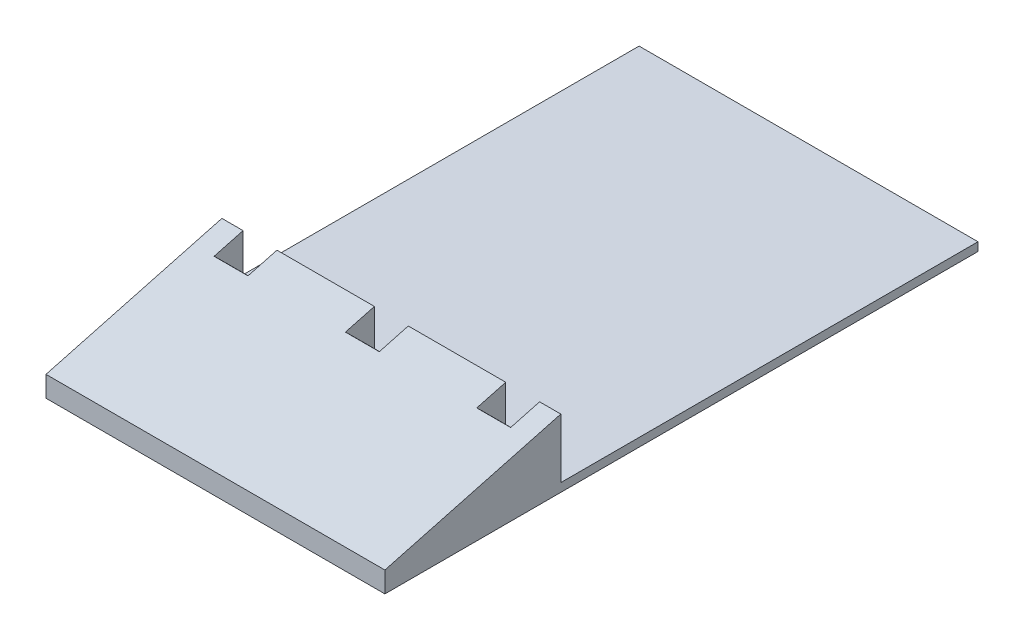
from build123d import *

# Parameters (mm, degrees)
SKETCH1_W                = 400
SKETCH1_H                = 700
BOSS_EXTRUDE1_DEPTH      = 10
BOSS_EXTRUDE2_DEPTH      = 200
BOSS_EXTRUDE2_DEPTH_BACK = 200
CUT_EXTRUDE3_DEPTH       = 20
CUT_EXTRUDE3_DEPTH_BACK  = 20
CUT_EXTRUDE4_DEPTH       = 20
CUT_EXTRUDE4_DEPTH_BACK  = 20
CUT_EXTRUDE5_DEPTH       = 20
CUT_EXTRUDE5_DEPTH_BACK  = 20
SHELL3_START             = -189.5
SHELL3_DEPTH             = 379
SHELL3_START_2           = -124.5
SHELL3_2_DEPTH           = 94
SHELL3_START_3           = 30.5
SHELL3_3_DEPTH           = 94
SHELL3_4_DEPTH           = 4
SHELL3_START_4           = 185.5
SHELL3_5_DEPTH           = 4
SHELL3_START_5           = -30.5
SHELL3_6_DEPTH           = 61
FILLET1_R                = 100


# Read off the part's stored shape, not the designer's step: Shell3
with BuildPart() as part:
    # Sketch1 → Boss-Extrude1 (new body)
    with BuildSketch(Plane(origin=(0, 0, 0), x_dir=(1, 0, 0), z_dir=(0, 1, 0))):
        with Locations((0, 350)):
            Rectangle(SKETCH1_W, SKETCH1_H)
    extrude(amount=BOSS_EXTRUDE1_DEPTH)

    # Sketch2 → Boss-Extrude2 (add, two sides: drawn at the far end of the back side and taken through both)
    with BuildSketch(Plane(origin=(0, 0, 0), x_dir=(0, 0, -1), z_dir=(1, 0, 0)).offset(-BOSS_EXTRUDE2_DEPTH_BACK)):
        Polygon((0, 0), (0, 24.464411704), (101.405231438, 51.629278733), (207.601036066, 80.077464993), (207.601036066, 0), align=None)
    extrude(amount=BOSS_EXTRUDE2_DEPTH + BOSS_EXTRUDE2_DEPTH_BACK)

    # Sketch5 → Cut-Extrude3 (cut, two sides: drawn at the far end of the back side and taken through both)
    with BuildSketch(Plane(origin=(0, 0, 0), x_dir=(0, 0, -1), z_dir=(1, 0, 0)).offset(-CUT_EXTRUDE3_DEPTH_BACK)):
        with BuildLine():
            Line((207.651134237, 88.230641516), (207.651134237, 10))
            ThreePointArc((207.651134237, 10), (195.644591457, 43.3333125), (173.411266827, 70.918563406))
            Line((173.411266827, 70.918563406), (207.651134237, 88.230641516))
        make_face()
    extrude(amount=CUT_EXTRUDE3_DEPTH + CUT_EXTRUDE3_DEPTH_BACK, mode=Mode.SUBTRACT)

    # Sketch7 → Cut-Extrude4 (cut, two sides: drawn at the far end of the back side and taken through both)
    with BuildSketch(Plane(origin=(155, 0, 0), x_dir=(0, 0, -1), z_dir=(1, 0, 0)).offset(-CUT_EXTRUDE4_DEPTH_BACK)):
        with BuildLine():
            Line((207.601036066, 80.077464993), (207.601036066, 10))
            ThreePointArc((207.601036066, 10), (195.617643187, 43.328041458), (173.411266827, 70.918563406))
            Line((173.411266827, 70.918563406), (164.696313807, 94.748714882))
            Line((164.696313807, 94.748714882), (211.114914406, 101.759857681))
            Line((211.114914406, 101.759857681), (207.601036066, 80.077464993))
        make_face()
    extrude(amount=CUT_EXTRUDE4_DEPTH + CUT_EXTRUDE4_DEPTH_BACK, mode=Mode.SUBTRACT)

    # Sketch8 → Cut-Extrude5 (cut, two sides: drawn at the far end of the back side and taken through both)
    with BuildSketch(Plane(origin=(-155, 0, 0), x_dir=(0, 0, -1), z_dir=(1, 0, 0)).offset(-CUT_EXTRUDE5_DEPTH_BACK)):
        with BuildLine():
            Line((207.601036066, 10), (207.601036066, 80.077464993))
            Line((207.601036066, 80.077464993), (173.411266827, 70.918563406))
            ThreePointArc((173.411266827, 70.918563406), (195.617643187, 43.328041458), (207.601036066, 10))
        make_face()
    extrude(amount=CUT_EXTRUDE5_DEPTH + CUT_EXTRUDE5_DEPTH_BACK, mode=Mode.SUBTRACT)

    # Shell3 outline → Shell3 (cut)
    with BuildSketch(Plane.YZ.offset(SHELL3_START)):
        with BuildLine():
            Line((10.5, -10.5), (10.5, -196.809675626))
            ThreePointArc((10.5, -196.809675626), (36.812126695, -187.219283255), (59.262427205, -170.477489921))
            Line((59.262427205, -170.477489921), (16.406973107, -10.5))
            Line((16.406973107, -10.5), (10.5, -10.5))
        make_face()
    extrude(amount=SHELL3_DEPTH, mode=Mode.SUBTRACT)

    # Shell3 2 outline → Shell3 2 (cut)
    with BuildSketch(Plane.YZ.offset(SHELL3_START_2)):
        with BuildLine():
            Line((10.5, -207.601036066), (69.207241495, -207.601036066))
            Line((69.207241495, -207.601036066), (59.262427205, -170.477489921))
            ThreePointArc((59.262427205, -170.477489921), (36.812126695, -187.219283255), (10.5, -196.809675626))
            Line((10.5, -196.809675626), (10.5, -207.601036066))
        make_face()
    extrude(amount=SHELL3_2_DEPTH, mode=Mode.SUBTRACT)

    # Shell3 3 outline → Shell3 3 (cut)
    with BuildSketch(Plane.YZ.offset(SHELL3_START_3)):
        with BuildLine():
            Line((10.5, -207.601036066), (69.207241495, -207.601036066))
            Line((69.207241495, -207.601036066), (59.262427205, -170.477489921))
            ThreePointArc((59.262427205, -170.477489921), (36.812126695, -187.219283255), (10.5, -196.809675626))
            Line((10.5, -196.809675626), (10.5, -207.601036066))
        make_face()
    extrude(amount=SHELL3_3_DEPTH, mode=Mode.SUBTRACT)

    # Shell3 4 outline → Shell3 4 (cut)
    with BuildSketch(Plane.YZ.offset(SHELL3_START)):
        with BuildLine():
            Line((10.5, -197.101036066), (66.394456595, -197.101036066))
            Line((66.394456595, -197.101036066), (59.262427205, -170.477489921))
            ThreePointArc((59.262427205, -170.477489921), (36.812126695, -187.219283255), (10.5, -196.809675626))
            Line((10.5, -196.809675626), (10.5, -197.101036066))
        make_face()
    extrude(amount=SHELL3_4_DEPTH, mode=Mode.SUBTRACT)

    # Shell3 5 outline → Shell3 5 (cut)
    with BuildSketch(Plane.YZ.offset(SHELL3_START_4)):
        with BuildLine():
            Line((10.5, -197.101036066), (66.394456595, -197.101036066))
            Line((66.394456595, -197.101036066), (59.262427205, -170.477489921))
            ThreePointArc((59.262427205, -170.477489921), (36.812126695, -187.219283255), (10.5, -196.809675626))
            Line((10.5, -196.809675626), (10.5, -197.101036066))
        make_face()
    extrude(amount=SHELL3_5_DEPTH, mode=Mode.SUBTRACT)

    # Shell3 6 outline → Shell3 6 (cut)
    with BuildSketch(Plane.YZ.offset(SHELL3_START_5)):
        with BuildLine():
            Line((10.5, -196.809675626), (10.5, -196.858395835))
            ThreePointArc((10.5, -196.858395835), (36.816809355, -187.247785942), (59.263801063, -170.482618469))
            Line((59.263801063, -170.482618469), (59.262427205, -170.477489921))
            ThreePointArc((59.262427205, -170.477489921), (36.812126695, -187.219283255), (10.5, -196.809675626))
        make_face()
    extrude(amount=SHELL3_6_DEPTH, mode=Mode.SUBTRACT)

    # Fillet1
    # the kernel refuses this fillet: 100 mm, written as the material it takes off along each edge
    with BuildSketch(Plane(origin=(30.5, 10.5, -207.601036066), x_dir=(0, -1.0, -9.585505722497512e-10), z_dir=(1, 0, 0)), Plane(origin=(-124.5, 10.5, -207.601036066), x_dir=(0, -1.0, -9.585505722497512e-10), z_dir=(1, 0, 0))) as fillet1_piece_1:
        with BuildLine():
            CenterArc((99.99999999, -9.987492273), FILLET1_R, 174.26803198, 5.731967965)
            Line((-1e-08, -9.987492177), (0, 0))
            Line((0, 0), (0.5, 0))
        make_face()
    extrude(amount=94, mode=Mode.SUBTRACT)


solid = part.part
